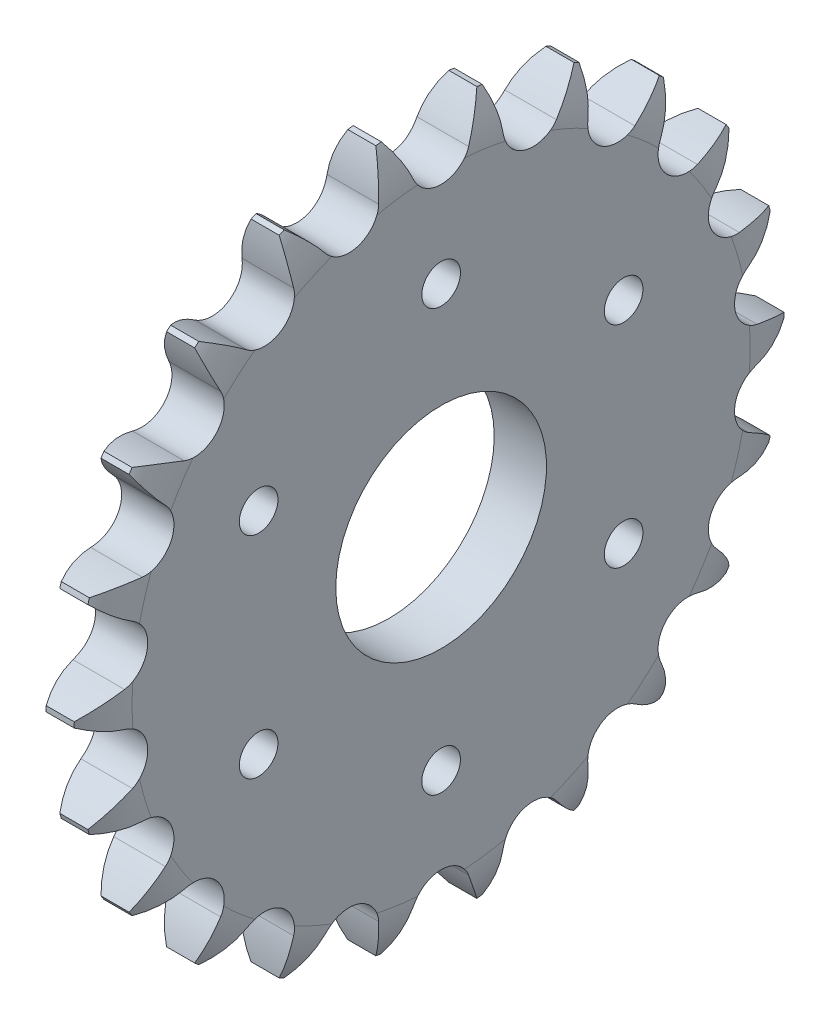
from build123d import *

# Parameters (mm, degrees)
TOOTHCUT_DEPTH              = 87.1879829
TEETHCUTS_COUNT             = 22
TEETHCUTS_ANGLE             = 343.636363636
BORSKE_R                    = 18
BORE_DEPTH                  = 50.0005
RIPETIZIONECIRCOLARE1_COUNT = 6


with BuildPart() as part:
    # BasProSke → Base-Revolve (revolve)
    with BuildSketch(Plane(origin=(0, 0, 0), x_dir=(1, 0, 0), z_dir=(0, 1, 0))):
        with BuildLine():
            Line((0, 0), (0, 52.788905316))
            ThreePointArc((0, 52.788905316), (0.524605563, 56.836252055), (2.06375, 60.616101393))
            Line((2.06375, 60.616101393), (6.86625, 60.616101393))
            ThreePointArc((6.86625, 60.616101393), (8.405394437, 56.836252055), (8.93, 52.788905316))
            Line((8.93, 52.788905316), (8.93, 0))
            Line((8.93, 0), (0, 0))
        make_face()
    revolve(axis=Axis((-10, 0, 0), (1, 0, 0)))

    # TooCutSke → ToothCut (cut, through all)
    with BuildSketch(Plane(origin=(0, 0, 0), x_dir=(0, 0, -1), z_dir=(1, 0, 0))):
        with BuildLine():
            ThreePointArc((4.755668616, 53.899221457), (6.414109214, 57.332731567), (8.504948237, 60.521431783))
            ThreePointArc((8.504948237, 60.521431783), (0, 61.116101393), (-8.504948237, 60.521431783))
            ThreePointArc((-8.504948237, 60.521431783), (-6.414109214, 57.332731567), (-4.755668616, 53.899221457))
            ThreePointArc((-4.755668616, 53.899221457), (0, 50.694226393), (4.755668616, 53.899221457))
        make_face()
    toothcut = extrude(amount=TOOTHCUT_DEPTH, mode=Mode.SUBTRACT)

    # TeethCuts: ToothCut ×22 about axis
    teethcuts_axis = Axis((-10, 0, 0), (1, 0, 0))
    for i in range(1, TEETHCUTS_COUNT):
        add(toothcut.rotate(teethcuts_axis, i * TEETHCUTS_ANGLE / (TEETHCUTS_COUNT - 1)), mode=Mode.SUBTRACT)

    # BorSke → Bore (cut, symmetric)
    with BuildSketch(Plane(origin=(0, 0, 0), x_dir=(0, 0, -1), z_dir=(1, 0, 0))):
        Circle(BORSKE_R)
    extrude(amount=BORE_DEPTH, both=True, mode=Mode.SUBTRACT)

    # Schizzo3 → Foro per Vite M6-1 (revolve, cut)
    with BuildSketch(Plane(origin=(8.93, 36, 0), x_dir=(0, 0, -1), z_dir=(0, 1, 0))):
        Polygon((0, 0), (0, 12), (3.3, 10.017159957), (3.3, 0), align=None)
    foro_per_vite_m6_1 = revolve(axis=Axis((15.28, 36, 0), (-1, 0, 0)), mode=Mode.SUBTRACT)

    # RipetizioneCircolare1: Foro per Vite M6-1 ×6 about axis
    ripetizionecircolare1_axis = Axis((8.93, 0, 0), (1, 0, 0))
    for i in range(1, RIPETIZIONECIRCOLARE1_COUNT):
        add(foro_per_vite_m6_1.rotate(ripetizionecircolare1_axis, i * 360 / RIPETIZIONECIRCOLARE1_COUNT), mode=Mode.SUBTRACT)


solid = part.part
